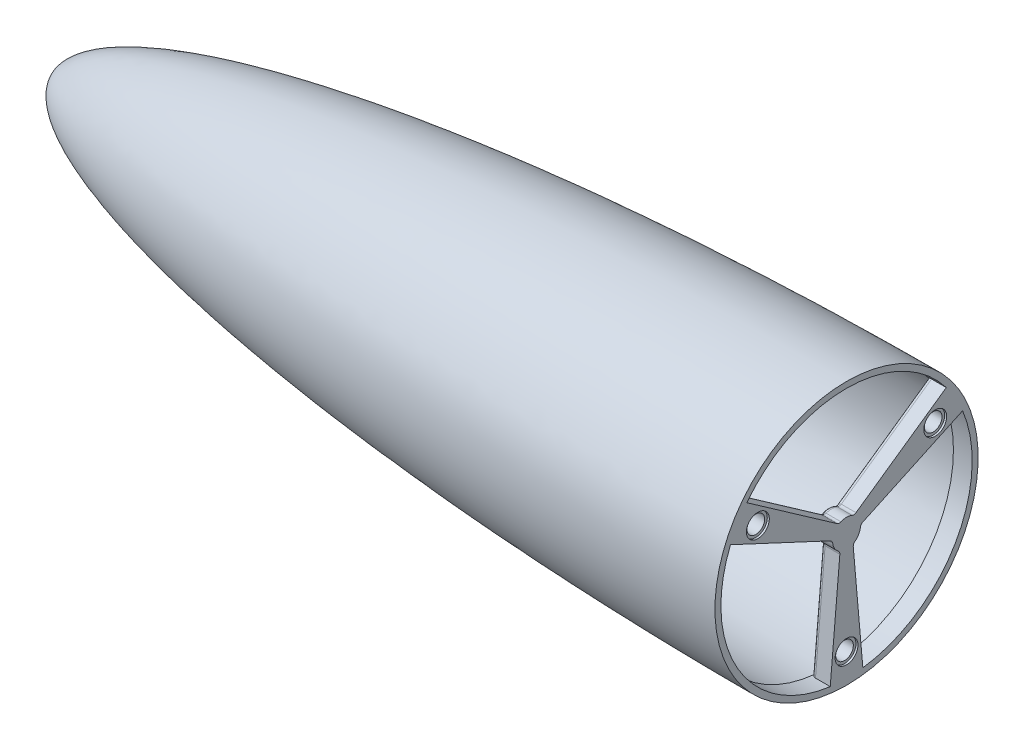
from build123d import *

# Parameters (mm, degrees)
CUT_EXTRUDE2_DEPTH = 4.7
FILLET5_R          = 1
FILLET6_R          = 1
CUT_EXTRUDE5_REACH = 205.426
SKETCH7_R          = 2.21
SKETCH8_R          = 2.87
CUT_EXTRUDE6_DEPTH = 0.51


# Read off the part's stored shape, not the designer's step: Revolve1
with BuildPart() as part:
    # Revolve1 outline → Revolve1 (revolve)
    with BuildSketch(Plane.YX):
        with BuildLine():
            Line((0, 0), (0, -4.7))
            Line((0, -4.7), (31.979035062, -4.7))
            add(Edge.make_bspline(
                [(31.979035062, -4.7), (31.959251529, -9.76133888), (31.842083495, -21.127910043), (31.407266725, -38.616209668), (30.646531755, -56.981644505), (29.247724013, -80.771456478), (26.801077565, -108.795133884), (22.855442714, -138.447604759), (18.848639177, -158.935559837), (15.305686541, -172.335427864), (12.508328071, -180.794747041), (9.604926022, -187.57552525), (7.135152293, -191.760944394), (5.172160549, -194.1958141), (3.723890241, -195.561422824), (2.559860808, -196.31938957), (1.655311155, -196.712861191), (1.224046505, -196.839554647), (1, -196.889137702)],
                knots=[-0.756043972, -0.756043972, -0.756043972, -0.756043972, -0.679216081, -0.583660827, -0.488105572, -0.392550317, -0.201439808, -0.010329298, 0.180781211, 0.276336466, 0.371891721, 0.467446976, 0.56300223, 0.610779858, 0.658557485, 0.706335112, 0.730223926, 0.75411274, 0.75411274, 0.75411274, 0.75411274], degree=3))
            Line((1, -196.889137702), (0, -131.041604603))
            Line((0, -131.041604603), (0, -198))
            add(Edge.make_bspline(
                [(0, -198), (0.198797999, -198), (0.398216073, -197.991018035), (0.598235548, -197.972942043), (0.798836944, -197.945661935), (1.492046919, -197.819565849), (1.987454153, -197.674349508), (2.485925405, -197.47184508), (2.987135221, -197.210562809), (7.97721512, -194.025597543), (12.663988353, -186.376160919), (17.265055189, -172.991477397), (21.382953272, -153.848054462), (26.864089998, -116.596825121), (28.689644131, -100.647367758), (30.152187391, -83.676561379), (31.241265569, -66.249926629), (32.360053654, -39.89435772), (32.647479203, -30.929055179), (32.844518679, -22.039610366), (32.956738694, -13.282235493), (32.994438692, -3.755644315), (32.997228295, -2.813409697), (32.999079102, -1.873353818), (33, -0.935532565), (33, 0)],
                knots=[6.249729389, 6.249729389, 6.249729389, 6.249729389, 6.249729389, 6.249729389, 6.283185307, 6.283185307, 6.283185307, 6.283185307, 6.36501883, 6.36501883, 6.36501883, 6.36501883, 7.094064485, 7.094064485, 7.094064485, 7.094064485, 7.555815604, 7.555815604, 7.555815604, 7.555815604, 7.794285427, 7.794285427, 7.794285427, 7.794285427, 7.820525716, 7.820525716, 7.820525716, 7.820525716, 7.820525716, 7.820525716], degree=5, weights=[1, 1, 1.000000003, 1.000000003, 1, 1, 1.000000069, 1.000000057, 1, 1, 0.998814248, 0.99838228, 1, 1, 0.999735723, 0.999780527, 1, 1, 0.999999893, 1.000002321, 1, 1, 1.000000001, 1.000000001, 1, 1]))
            Line((33, 0), (0, 0))
        make_face()
    revolve(axis=Axis((0, 0, 0), (1, 0, 0)))

    # Sketch4 → Cut-Extrude2 (cut)
    with BuildSketch(Plane(origin=(0, 0, 0), x_dir=(0, 0, -1), z_dir=(1, 0, 0))):
        with BuildLine():
            Line((1.870560785, 2.958209314), (25.005062511, 19.157161815))
            ThreePointArc((25.005062511, 19.157161815), (0, 31.5), (-25.005062511, 19.157161815))
            Line((-25.005062511, 19.157161815), (-1.870560785, 2.958209314))
            ThreePointArc((-1.870560785, 2.958209314), (0, 3.5), (1.870560785, 2.958209314))
        make_face()
        with BuildLine():
            Line((3.497164809, 0.140848502), (29.093120052, 12.07643845))
            ThreePointArc((29.093120052, 12.07643845), (27.279800219, -15.75), (4.088057541, -31.233600265))
            Line((4.088057541, -31.233600265), (1.626604023, -3.099057817))
            ThreePointArc((1.626604023, -3.099057817), (3.031088913, -1.75), (3.497164809, 0.140848502))
        make_face()
        with BuildLine():
            Line((-1.626604023, -3.099057817), (-4.088057541, -31.233600265))
            ThreePointArc((-4.088057541, -31.233600265), (-27.279800219, -15.75), (-29.093120052, 12.07643845))
            Line((-29.093120052, 12.07643845), (-3.497164809, 0.140848502))
            ThreePointArc((-3.497164809, 0.140848502), (-3.031088913, -1.75), (-1.626604023, -3.099057817))
        make_face()
    extrude(amount=-CUT_EXTRUDE2_DEPTH, mode=Mode.SUBTRACT)

    # Fillet5
    fillet5_edges = [part.edges().sort_by_distance(p)[0] for p in [
        (-4.7, -1.75, 3.031088913),
        (-4.7, -17.166329041, 2.857330782),
        (-4.7, 6.108643476, 16.29514243),
        (-4.7, -1.75, -3.031088913),
        (-4.7, 6.108643476, -16.29514243),
        (-4.7, -17.166329041, -2.857330782),
        (-4.7, 3.5, 0),
        (-4.7, 11.057685565, 13.437811648),
        (-4.7, 11.057685565, -13.437811648),
    ]]
    fillet(fillet5_edges, radius=FILLET5_R)

    # Fillet6
    fillet6_edges = [part.edges().sort_by_distance(p)[0] for p in [
        (-4.450912884, -2.894942447, 1.267850288),
        (-4.450912816, 0.349480612, 3.141018939),
        (-4.450912897, 2.545461767, -1.873168557),
        (-4.450912816, 2.545461889, 1.873168557),
        (-4.450912816, -2.894942501, -1.267850382),
        (-4.450912884, 0.349480665, -3.141018846),
        (-1.85, 0.140848502, 3.497164809),
        (-1.85, 2.958209314, 1.870560785),
        (-1.85, 2.958209314, -1.870560785),
        (-1.85, 0.140848502, -3.497164809),
        (-1.85, -3.099057817, -1.626604023),
        (-1.85, -3.099057817, 1.626604023),
    ]]
    fillet(fillet6_edges, radius=FILLET6_R)

    # Sketch7 → Cut-Extrude5 (cut, up to next)
    with BuildSketch(Plane(origin=(0, 0, 0), x_dir=(0, 0, -1), z_dir=(1, 0, 0)), mode=Mode.PRIVATE) as cut_extrude5_sk1:
        with Locations(Location((0, -25.67453, 0), (0, 0, 90))):
            Circle(SKETCH7_R)
    cut_extrude5_tool1 = extrude(cut_extrude5_sk1.sketch, amount=-CUT_EXTRUDE5_REACH, mode=Mode.PRIVATE) & part.part
    # Sketch7 → Cut-Extrude5 (cut, up to next)
    with BuildSketch(Plane(origin=(0, 0, 0), x_dir=(0, 0, -1), z_dir=(1, 0, 0)), mode=Mode.PRIVATE) as cut_extrude5_sk2:
        with Locations(Location((-22.23479521, 12.837265, 0), (0, 0, 90))):
            Circle(SKETCH7_R)
    cut_extrude5_tool2 = extrude(cut_extrude5_sk2.sketch, amount=-CUT_EXTRUDE5_REACH, mode=Mode.PRIVATE) & part.part
    # Sketch7 → Cut-Extrude5 (cut, up to next)
    with BuildSketch(Plane(origin=(0, 0, 0), x_dir=(0, 0, -1), z_dir=(1, 0, 0)), mode=Mode.PRIVATE) as cut_extrude5_sk3:
        with Locations(Location((22.23479521, 12.837265, 0), (0, 0, 90))):
            Circle(SKETCH7_R)
    cut_extrude5_tool3 = extrude(cut_extrude5_sk3.sketch, amount=-CUT_EXTRUDE5_REACH, mode=Mode.PRIVATE) & part.part
    add(cut_extrude5_tool1.solids().sort_by_distance((0, -25.67453, 0))[0], mode=Mode.SUBTRACT)
    add(cut_extrude5_tool2.solids().sort_by_distance((0, 12.837265, 22.234795))[0], mode=Mode.SUBTRACT)
    add(cut_extrude5_tool3.solids().sort_by_distance((0, 12.837265, -22.234795))[0], mode=Mode.SUBTRACT)

    # Sketch8 → Cut-Extrude6 (cut)
    with BuildSketch(Plane(origin=(0, 0, 0), x_dir=(0, 0, -1), z_dir=(1, 0, 0))):
        with Locations(Location((0, -25.67453, 0), (0, 0, 90))):
            Circle(SKETCH8_R)
        with Locations(Location((-22.23479521, 12.837265, 0), (0, 0, 90))):
            Circle(SKETCH8_R)
        with Locations(Location((22.23479521, 12.837265, 0), (0, 0, 90))):
            Circle(SKETCH8_R)
    extrude(amount=-CUT_EXTRUDE6_DEPTH, mode=Mode.SUBTRACT)


solid = part.part
